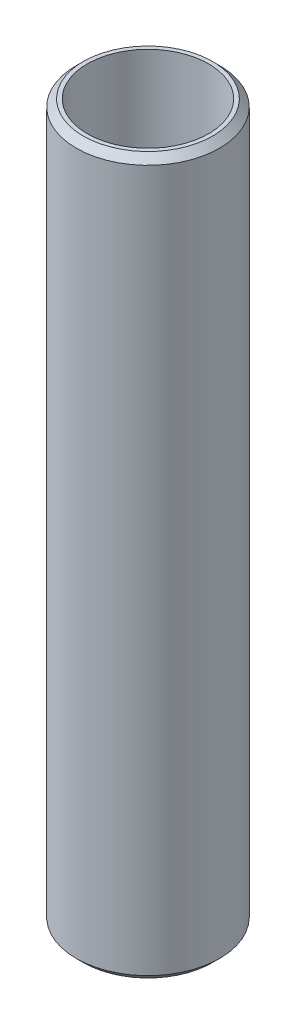
from build123d import *

# Parameters (mm, degrees)
SKETCH1_R           = 55
BOSS_EXTRUDE1_DEPTH = 549.525610162
SKETCH2_R           = 46.548285629
CUT_EXTRUDE1_DEPTH  = 556.003059652
CHAMFER1_SIZE       = 5.36973491


with BuildPart() as part:
    # Sketch1 → Boss-Extrude1 (new body)
    with BuildSketch(Plane(origin=(0, 0, 0), x_dir=(1, 0, 0), z_dir=(0, 1, 0))):
        Circle(SKETCH1_R)
    extrude(amount=BOSS_EXTRUDE1_DEPTH)

    # Sketch2 → Cut-Extrude1 (cut, through all)
    with BuildSketch(Plane(origin=(0, 0, 0), x_dir=(1, 0, 0), z_dir=(0, 1, 0))):
        Circle(SKETCH2_R)
    extrude(amount=CUT_EXTRUDE1_DEPTH, mode=Mode.SUBTRACT)

    # Chamfer1
    chamfer1_edges = [part.edges().sort_by_distance(p)[0] for p in [
        (-55, 549.525610162, 0),
        (-55, 0, 0),
    ]]
    chamfer(chamfer1_edges, length=CHAMFER1_SIZE)


solid = part.part
